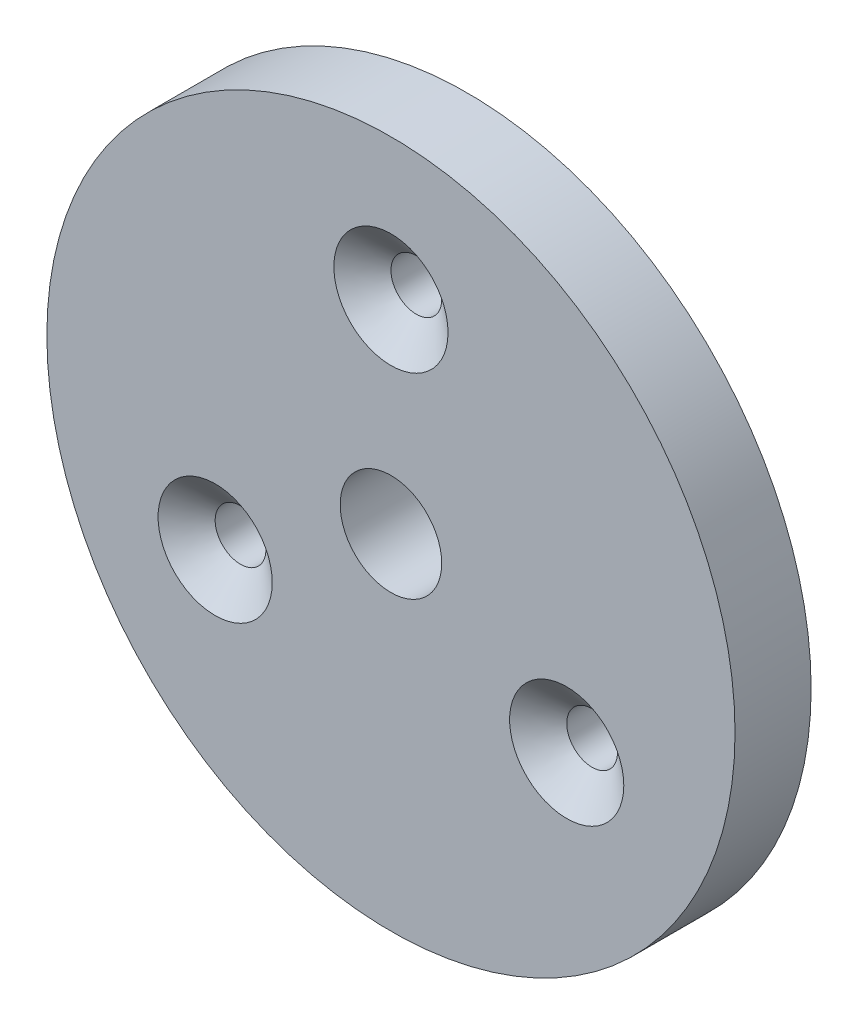
from build123d import *

# Parameters (mm, degrees)
SKETCH3_R           = 27.125
SKETCH3_R_2         = 4
SKETCH3_R_3         = 2
BOSS_EXTRUDE1_DEPTH = 6
CHAMFER1_SIZE       = 2.5
CHAMFER1_SIZE2      = 2


with BuildPart() as part:
    # Sketch3 → Boss-Extrude1 (new body)
    with BuildSketch(Plane(origin=(0, 0, 0), x_dir=(0, 1, 0), z_dir=(0, 0, 1))):
        Circle(SKETCH3_R)
        Circle(SKETCH3_R_2, mode=Mode.SUBTRACT)
        with Locations((16, 0)):
            Circle(SKETCH3_R_3, mode=Mode.SUBTRACT)
        with Locations((-8, -13.856406461)):
            Circle(SKETCH3_R_3, mode=Mode.SUBTRACT)
        with Locations((-8, 13.856406461)):
            Circle(SKETCH3_R_3, mode=Mode.SUBTRACT)
    extrude(amount=BOSS_EXTRUDE1_DEPTH)

    # Chamfer1
    chamfer1_edges = [part.edges().sort_by_distance(p)[0] for p in [
        (-13.856406461, -10, 6),
        (13.856406461, -10, 6),
        (0, 14, 6),
    ]]
    chamfer1_side = [part.faces().sort_by_distance(p)[0] for p in [
        (0, -26.357789142, 6),
    ]]
    chamfer(chamfer1_edges, length=CHAMFER1_SIZE, length2=CHAMFER1_SIZE2, reference=chamfer1_side[0])


solid = part.part
